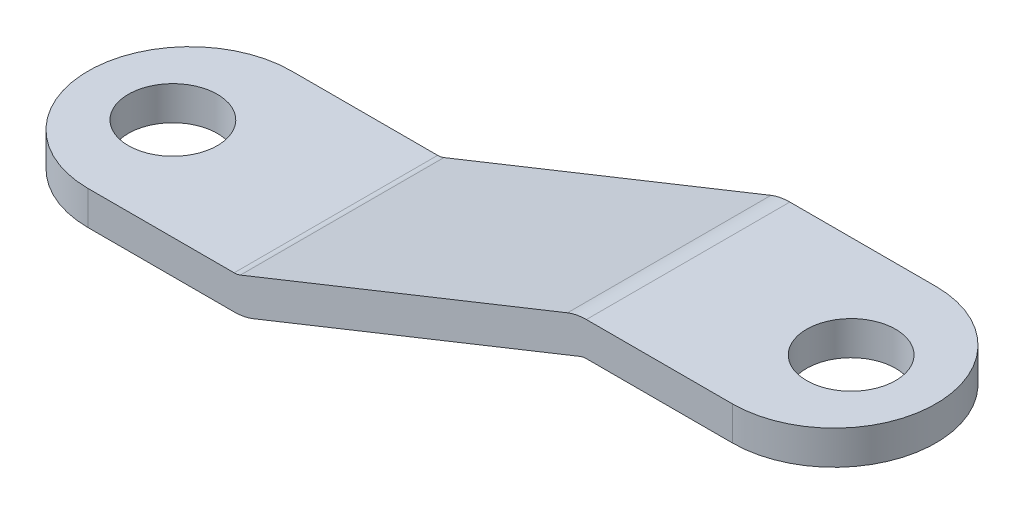
from build123d import *

# Parameters (mm, degrees)
EXTRUDE_THIN1_DEPTH = 4.8
SKETCH2_R           = 2.1
CUT_EXTRUDE1_DEPTH  = 41.792156109
SKETCH3_R           = 2.1
CUT_EXTRUDE2_DEPTH  = 42.07359249
FILLET1_R           = 4.8


with BuildPart() as part:
    # Sketch1 → Extrude-Thin1 (new body)
    with BuildSketch(Plane.XY):
        with BuildLine():
            Line((0, -0.8), (11.691868154, -0.8))
            ThreePointArc((11.691868154, -0.8), (12.145726205, -0.756695328), (12.583205778, -0.628344058))
            Line((12.583205778, -0.628344058), (28.011019305, 5.542781353))
            ThreePointArc((28.011019305, 5.542781353), (28.156845829, 5.585565109), (28.308131846, 5.6))
            Line((28.308131846, 5.6), (40, 5.6))
            Line((40, 5.6), (40, 7.2))
            Line((40, 7.2), (28.308131846, 7.2))
            ThreePointArc((28.308131846, 7.2), (27.854273795, 7.156695328), (27.416794222, 7.028344058))
            Line((27.416794222, 7.028344058), (11.988980695, 0.857218647))
            ThreePointArc((11.988980695, 0.857218647), (11.843154171, 0.814434891), (11.691868154, 0.8))
            Line((11.691868154, 0.8), (0, 0.8))
            Line((0, 0.8), (0, -0.8))
        make_face()
    extrude(amount=EXTRUDE_THIN1_DEPTH)

    # Sketch2 → Cut-Extrude1 (cut, through all)
    with BuildSketch(Plane(origin=(0, 0.8, 0), x_dir=(1, 0, 0), z_dir=(0, 1, 0))):
        with Locations((4, 0)):
            Circle(SKETCH2_R)
    extrude(amount=-CUT_EXTRUDE1_DEPTH, mode=Mode.SUBTRACT)

    # Sketch3 → Cut-Extrude2 (cut, through all)
    with BuildSketch(Plane(origin=(0, 7.2, 0), x_dir=(1, 0, 0), z_dir=(0, 1, 0))):
        with Locations((36, 0)):
            Circle(SKETCH3_R)
    extrude(amount=-CUT_EXTRUDE2_DEPTH, mode=Mode.SUBTRACT)

    # Fillet1
    fillet1_edges = [part.edges().sort_by_distance(p)[0] for p in [
        (0, 0, 4.8),
        (40, 6.4, 4.8),
    ]]
    fillet(fillet1_edges, radius=FILLET1_R - 0.0001)  # a hair under: the kernel refuses the full size

    # Mirror1: part across plane


with BuildPart() as part_1:
    add(part.part)
    add(part.part.mirror(Plane(origin=(28.308131846, 4.8, 0), x_dir=(1, 0, 0), z_dir=(0, 0, 1))))


solid = part_1.part
